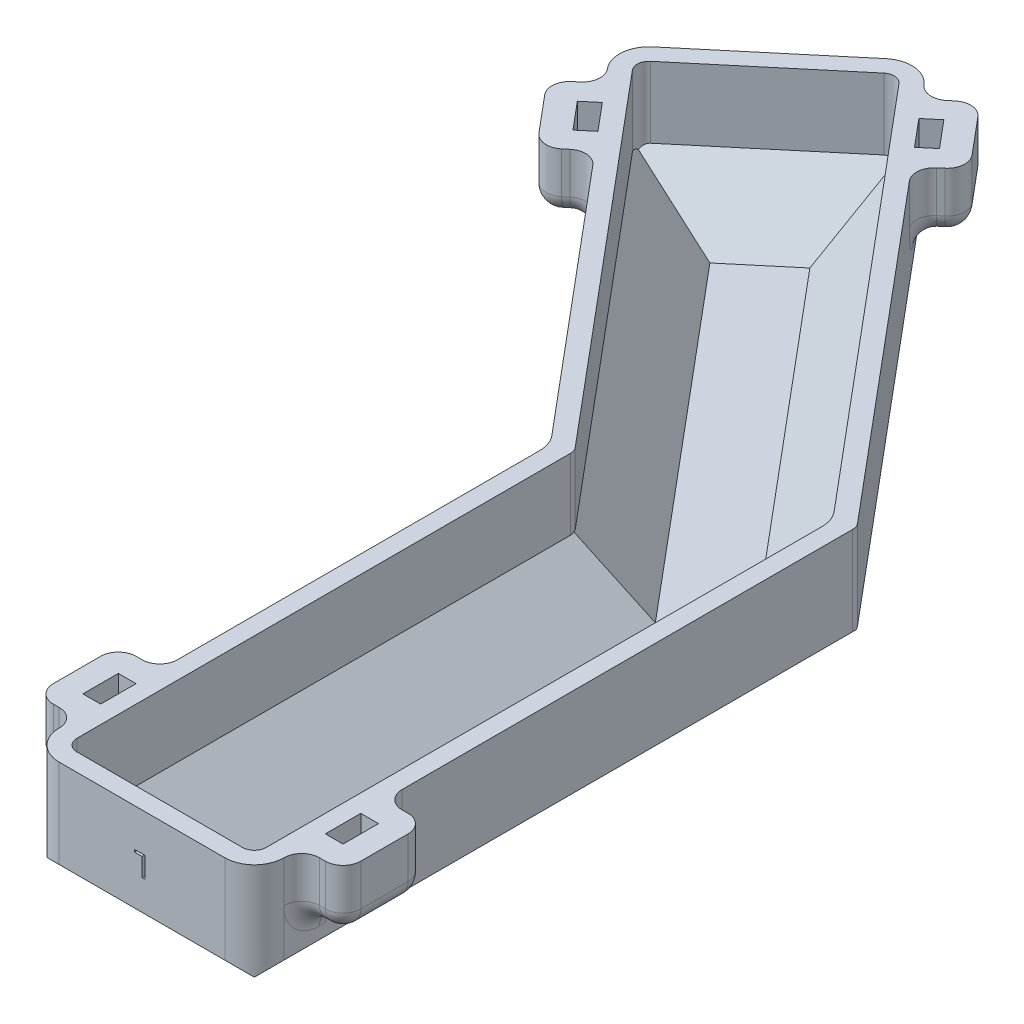
from build123d import *

# Parameters (mm, degrees)
BOSS_EXTRUDE1_DEPTH = 25
CUT_EXTRUDE1_DEPTH  = 22
CHAMFER1_SIZE       = 10
FILLET1_R           = 2
FILLET2_R           = 5
CUT_EXTRUDE4_DEPTH  = 0.5
BOSS_EXTRUDE2_DEPTH = 7
BOSS_EXTRUDE3_DEPTH = 7
BOSS_EXTRUDE4_DEPTH = 7
BOSS_EXTRUDE5_DEPTH = 7
SKETCH10_W          = 3
SKETCH10_H          = 6
CUT_EXTRUDE5_DEPTH  = 123.16586282655703
FILLET3_R           = 3


with BuildPart() as part:
    # Sketch1 → Boss-Extrude1 (new body)
    with BuildSketch(Plane(origin=(0, 0, 0), x_dir=(1, 0, 0), z_dir=(0, 1, 0))):
        Polygon((19, -95), (19, 6.9154344510577115), (-43.296040452526896, 81.15696446475283), (-72.40572929104839, 56.73103529666472), (-18.999999999999996, -6.915434451057793), (-19, -95), align=None)
    extrude(amount=BOSS_EXTRUDE1_DEPTH)

    # Sketch2 → Cut-Extrude1 (cut)
    with BuildSketch(Plane(origin=(0, 25, 0), x_dir=(1, 0, 0), z_dir=(0, 1, 0))):
        Polygon((-68.17923313263185, 56.36126479636737), (-43.66581095282428, 76.93046830633632), (16, 5.823523748259106), (16.00000000000001, -92), (-15.99999999999999, -92), (-15.999999999999996, -5.823523748259207), align=None)
    extrude(amount=-CUT_EXTRUDE1_DEPTH, mode=Mode.SUBTRACT)

    # Chamfer1
    chamfer1_edges = [part.edges().sort_by_distance(p)[0] for p in [
        (-42.089616566315925, 3, -25.26887052405408),
        (-55.92252204272806, 3, -66.64586655135184),
        (-13.83290547641214, 3, -41.376996027297714),
        (16.000000000000007, 3, 43.08823812587045),
        (1.066e-14, 3, 92),
        (-15.999999999999993, 3, 48.9117618741296),
        (-18.999999999999996, 0, 50.957717225528896),
        (-45.7028646455242, 0, -24.90780042280347),
        (-57.85088487178764, 0, -68.94399988070877),
        (-12.148020226263444, 0, -44.036199457905276),
        (19, 0, 44.04228277447115),
        (0, 0, 95),
    ]]
    chamfer(chamfer1_edges, length=CHAMFER1_SIZE)

    # Fillet1
    fillet1_edges = [part.edges().sort_by_distance(p)[0] for p in [
        (19, 17.5, -6.9154344510577115),
        (-68.17923313263185, 19, -56.36126479636737),
        (-43.66581095282428, 19, -76.93046830633632),
        (16.00000000000001, 19, 92),
        (-15.99999999999999, 19, 92),
        (-15.999999999999996, 19, 5.823523748259207),
    ]]
    fillet(fillet1_edges, radius=FILLET1_R)

    # Fillet2
    fillet2_edges = [part.edges().sort_by_distance(p)[0] for p in [
        (-19, 17.5, 95),
        (-18.999999999999996, 17.5, 6.915434451057793),
        (-72.40572929104839, 17.5, -56.73103529666472),
        (-43.296040452526896, 17.5, -81.15696446475283),
        (19, 17.5, 95),
        (16, 19, -5.823523748259106),
    ]]
    fillet(fillet2_edges, radius=FILLET2_R)

    # Sketch9 → Cut-Extrude4 (cut)
    with BuildSketch(Plane.XY.offset(95)):
        Polygon((0.4844994416495535, 15.096060671986343), (0.03578149293160474, 15.096060671986343), (0.03578149293160474, 18.19221451814019), (-1.2655005583504468, 18.19221451814019), (-1.2655005583504468, 18.596060671986343), (0.4844994416495535, 18.596060671986343), align=None)
    extrude(amount=-CUT_EXTRUDE4_DEPTH, mode=Mode.SUBTRACT)

    # Sketch3 → Boss-Extrude2 (add)
    with BuildSketch(Plane(origin=(-14.554844419260807, 0, 12.212964584044096), x_dir=(0.6427876096865288, 0, 0.766044443118987), z_dir=(-0.766044443118987, 0, 0.6427876096865288))):
        Polygon((-68, 15.000000000000004), (-82.00000000000001, 15.000000000000002), (-82.00000000000001, 25), (-68.00000000000001, 25), align=None)
    extrude(amount=BOSS_EXTRUDE2_DEPTH)

    # Sketch4 → Boss-Extrude3 (add)
    with BuildSketch(Plane(origin=(14.554844419260744, 0, -12.212964584044062), x_dir=(-0.6427876096865294, 0, -0.7660444431189866), z_dir=(0.7660444431189866, 0, -0.6427876096865294))):
        Polygon((82.00000000000001, 15.000000000000002), (68.00000000000001, 14.999999999999998), (68.00000000000001, 25), (82.00000000000001, 25), align=None)
    extrude(amount=BOSS_EXTRUDE3_DEPTH)

    # Sketch6 → Boss-Extrude4 (add)
    with BuildSketch(Plane.ZY.offset(18.999999999999996)):
        Polygon((87, 15.000000000000002), (73, 15), (72.99999999999999, 25), (87, 25), align=None)
    extrude(amount=BOSS_EXTRUDE4_DEPTH)

    # Sketch7 → Boss-Extrude5 (add)
    with BuildSketch(Plane(origin=(19, 0, 0), x_dir=(0, 0, -1), z_dir=(1, 0, 0))):
        Polygon((-73, 15.000000000000004), (-87, 15.000000000000002), (-87, 25), (-73, 25), align=None)
    extrude(amount=BOSS_EXTRUDE5_DEPTH)

    # Sketch10 → Cut-Extrude5 (cut, through all)
    with BuildSketch(Plane(origin=(0, 25, 0), x_dir=(1, 0, 0), z_dir=(0, 1, 0))):
        Polygon((-66.99041130416701, 45.61013915017732), (-64.69227797481005, 47.53850197923691), (-60.83555231669091, 42.942235320523), (-63.13368564604784, 41.013872491463395), align=None)
        Polygon((-35.582589136288576, 71.96443114732502), (-33.28445580693161, 73.8927939763846), (-29.427730148812422, 69.29652731767068), (-31.725863478169394, 67.3681644886111), align=None)
        with Locations((-20.499999999999996, -79.99999999999999)):
            Rectangle(SKETCH10_W, SKETCH10_H)
        with Locations((20.5, -80)):
            Rectangle(SKETCH10_W, SKETCH10_H)
    extrude(amount=-CUT_EXTRUDE5_DEPTH, mode=Mode.SUBTRACT)

    # Fillet3
    fillet3_edges = [part.edges().sort_by_distance(p)[0] for p in [
        (-58.26440187794476, 20, -39.878057548047025),
        (-65.97785319418313, 15.000000000000002, -49.07059086547488),
        (19, 20, 87),
        (19, 15.000000000000004, 75),
        (-18.999999999999996, 20, 87),
        (-18.999999999999996, 20, 73),
        (-29.154713039423243, 20, -64.30398671613516),
        (-38.153739575034656, 20, -75.02860891980096),
        (-60.94555742886122, 15.000000000000004, -37.62830091414418),
        (-59.549977097317836, 15.000000000000004, -41.410146434285004),
        (-63.62671297977768, 20, -35.37854428024132),
        (-67.26342841355618, 20, -50.60267975171285),
        (-72.62573951538909, 20, -46.103166483907145),
        (-68.12622624758338, 15.000000000000004, -40.74085538207423),
        (-69.94458396447264, 15.000000000000002, -48.35292311781),
        (26, 20, 87),
        (22.5, 15.000000000000002, 87),
        (19, 15.000000000000002, 85),
        (26, 15.000000000000004, 80),
        (19, 20, 73),
        (22.5, 15.000000000000004, 73),
        (26, 20, 73),
        (-25.999999999999996, 20, 87),
        (-22.499999999999996, 15.000000000000002, 87),
        (-18.999999999999996, 15.000000000000002, 85),
        (-18.999999999999996, 15, 75),
        (-25.999999999999996, 15, 80),
        (-25.999999999999996, 20, 73),
        (-22.499999999999996, 15, 73),
        (-30.440288258796315, 14.999999999999998, -65.83607560237314),
        (-26.47355748850679, 14.999999999999998, -66.553743350038),
        (-23.792401937590338, 20, -68.80349998394087),
        (-35.472584024118206, 15.000000000000002, -77.27836555370381),
        (-28.29191520539604, 15, -74.16581108577375),
        (-36.868164355661605, 15.000000000000002, -73.496520033563),
        (-32.79142847320175, 20, -79.52812218760667),
    ]]
    fillet(fillet3_edges, radius=FILLET3_R - 0.0001)  # a hair under: the kernel refuses the full size


solid = part.part
